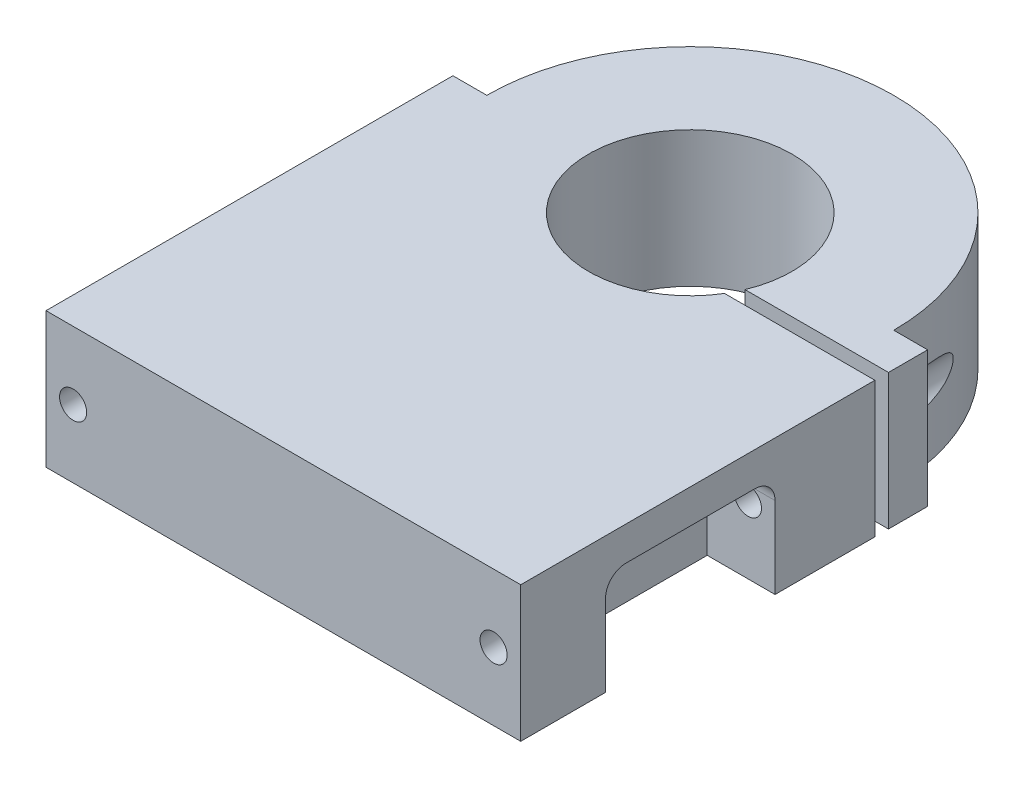
from build123d import *

# Parameters (mm, degrees)
SKETCH_1_R               = 15
EXTRUDE_1_DEPTH          = 20
SKETCH_2_W               = 80.970939558
SKETCH_2_H               = 2
CUT_EXTRUDE_1_DEPTH      = 73.284161474
SKETCH_3_W               = 25
SKETCH_3_H               = 30
CUT_EXTRUDE_2_DEPTH      = 10
FILLET_1_R               = 3
CUT_EXTRUDE_3_DEPTH      = 53
CUT_EXTRUDE_3_DEPTH_BACK = 5
SKETCH_4_R               = 3
SKETCH_5_R               = 2
CUT_EXTRUDE_4_DEPTH      = 69.190908514
SKETCH_6_R               = 3
CUT_EXTRUDE_5_DEPTH      = 3
MIRROR_START             = -35
MIRROR_1_DEPTH           = 10
MIRROR_START_2           = 17.3284275
MIRROR_1_2_OUTLINE_R     = 3
MIRROR_1_2_DEPTH         = 3.1715725
SKETCH_7_R               = 2
CUT_EXTRUDE_6_DEPTH      = 42


with BuildPart() as part:
    # 草图1 → 凸台-拉伸1 (new body)
    with BuildSketch(Plane(origin=(0, 0, 0), x_dir=(1, 0, 0), z_dir=(0, 1, 0))):
        with BuildLine():
            Line((-30, 30), (-35, 30))
            Line((-35, 30), (-35, -30))
            Line((-35, -30), (35, -30))
            Line((35, -30), (35, 30))
            Line((35, 30), (30, 30))
            ThreePointArc((30, 30), (0, 60), (-30, 30))
        make_face()
        with Locations(Location((0, 30, 0), (0, 0, 270))):
            Circle(SKETCH_1_R, mode=Mode.SUBTRACT)
    extrude(amount=EXTRUDE_1_DEPTH)

    # 草图2 → 切除-拉伸1 (cut, through all)
    with BuildSketch(Plane(origin=(0, 20, 0), x_dir=(1, 0, 0), z_dir=(0, 1, 0))):
        with Locations((35, 23.224842932)):
            Rectangle(SKETCH_2_W, SKETCH_2_H)
    extrude(amount=-CUT_EXTRUDE_1_DEPTH, mode=Mode.SUBTRACT)

    # 草图3 → 切除-拉伸2 (cut)
    with BuildSketch(Plane(origin=(35, 0, 0), x_dir=(0, 0, -1), z_dir=(1, 0, 0))):
        with Locations((-5, 0)):
            Rectangle(SKETCH_3_W, SKETCH_3_H)
    extrude(amount=-CUT_EXTRUDE_2_DEPTH, mode=Mode.SUBTRACT)

    # 圆角1
    fillet_1_edges = [part.edges().sort_by_distance(p)[0] for p in [
        (30, 15, -7.5),
        (30, 15, 17.5),
    ]]
    fillet(fillet_1_edges, radius=FILLET_1_R)

    # 草图4 → 切除-拉伸3 (cut, two sides: drawn at the far end of the back side and taken through both)
    with BuildSketch(Plane(origin=(0, 0, -30), x_dir=(-1, 0, 0), z_dir=(0, 0, -1)).offset(-CUT_EXTRUDE_3_DEPTH_BACK)):
        with Locations(Location((-31, 10, 0), (0, 0, 70.528779366))):
            Circle(SKETCH_4_R)
    extrude(amount=CUT_EXTRUDE_3_DEPTH + CUT_EXTRUDE_3_DEPTH_BACK, mode=Mode.SUBTRACT)

    # 草图5 → 切除-拉伸4 (cut, through all)
    with BuildSketch(Plane(origin=(0, 0, -25), x_dir=(-1, 0, 0), z_dir=(0, 0, -1))):
        with Locations((-31, 10)):
            Circle(SKETCH_5_R)
    extrude(amount=-CUT_EXTRUDE_4_DEPTH, mode=Mode.SUBTRACT)

    # 草图6 → 切除-拉伸5 (cut, symmetric)
    with BuildSketch(Plane(origin=(0, 0, 17.5), x_dir=(-1, 0, 0), z_dir=(0, 0, -1))):
        with Locations(Location((-31, 10, 0), (0, 0, 70.528779366))):
            Circle(SKETCH_6_R)
    extrude(amount=CUT_EXTRUDE_5_DEPTH, both=True, mode=Mode.SUBTRACT)

    # 镜向1: read off the stored shape, not the designer's step
    # 镜向1 outline → 镜向1 (cut)
    with BuildSketch(Plane.YZ.offset(MIRROR_START)):
        with BuildLine():
            Line((12, 17.5), (0, 17.5))
            Line((0, 17.5), (0, -7.5))
            Line((0, -7.5), (12, -7.5))
            ThreePointArc((12, -7.5), (14.121320344, -6.621320344), (15, -4.5))
            Line((15, -4.5), (15, 14.5))
            ThreePointArc((15, 14.5), (14.121320344, 16.621320344), (12, 17.5))
        make_face()
    extrude(amount=MIRROR_1_DEPTH, mode=Mode.SUBTRACT)

    # Mirror 1 2 outline → Mirror 1 2 (cut)
    with BuildSketch(Plane.XY.offset(MIRROR_START_2)):
        with Locations((-31, 10)):
            Circle(MIRROR_1_2_OUTLINE_R)
    extrude(amount=MIRROR_1_2_DEPTH, mode=Mode.SUBTRACT)

    # 草图7 → 切除-拉伸6 (cut)
    with BuildSketch(Plane(origin=(0, 0, 20.5), x_dir=(-1, 0, 0), z_dir=(0, 0, -1))):
        with Locations((31, 10)):
            Circle(SKETCH_7_R)
    extrude(amount=-CUT_EXTRUDE_6_DEPTH, mode=Mode.SUBTRACT)


solid = part.part
